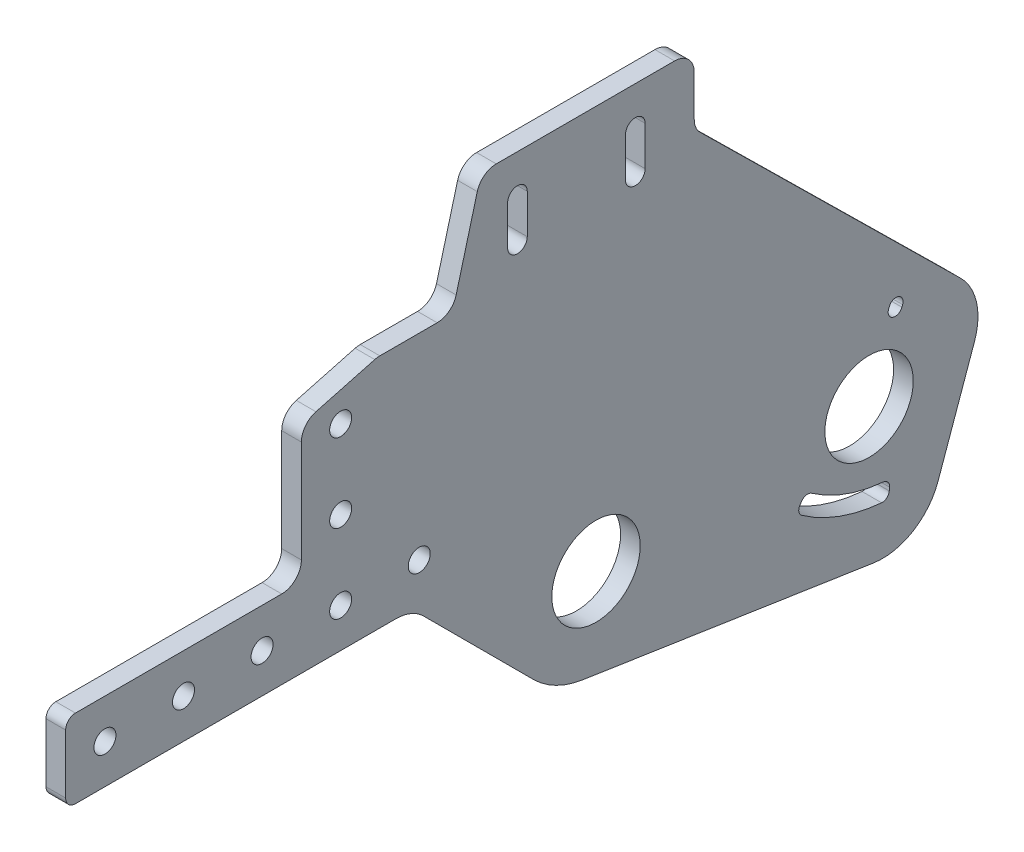
from build123d import *

# Parameters (mm, degrees)
SKETCH2_R           = 14.2875
SKETCH2_R_2         = 3.556
BOSS_EXTRUDE1_DEPTH = 6.35


with BuildPart() as part:
    # Sketch2 → Boss-Extrude1 (new body)
    with BuildSketch(Plane(origin=(0, 0, 0), x_dir=(0, 0, -1), z_dir=(1, 0, 0))):
        with BuildLine():
            Line((-168.275, 19.05), (-64.721664787, 19.05))
            ThreePointArc((-64.721664787, 19.05), (-59.861585196, 18.083270063), (-55.741408666, 15.330256121))
            Line((-55.741408666, 15.330256121), (-20.205576272, -20.205576272))
            ThreePointArc((-20.205576272, -20.205576272), (-12.892391565, -25.501311039), (-4.291950596, -28.250836892))
            Line((-4.291950596, -28.250836892), (89.747072838, -42.537523132))
            ThreePointArc((89.747072838, -42.537523132), (102.395293911, -40.047397767), (110.561944691, -30.073229346))
            Line((110.561944691, -30.073229346), (122.380407257, 3.238704882))
            ThreePointArc((122.380407257, 3.238704882), (122.992543265, 13.876440872), (117.796290753, 23.178865142))
            Line((117.796290753, 23.178865142), (33.643515016, 106.084545773))
            ThreePointArc((33.643515016, 106.084545773), (32.242475794, 108.156147009), (31.75, 110.608066701))
            Line((31.75, 110.608066701), (31.75, 123.825))
            ThreePointArc((31.75, 123.825), (29.890128061, 128.315128061), (25.4, 130.175))
            Line((25.4, 130.175), (-32.251185784, 130.175))
            ThreePointArc((-32.251185784, 130.175), (-36.116820858, 128.862793711), (-38.384814781, 125.468500936))
            Line((-38.384814781, 125.468500936), (-45.22073508, 99.956499064))
            ThreePointArc((-45.22073508, 99.956499064), (-47.488729003, 96.562206289), (-51.354364077, 95.25))
            Line((-51.354364077, 95.25), (-69.879490653, 95.25))
            ThreePointArc((-69.879490653, 95.25), (-70.708331973, 95.19567487), (-71.522991589, 95.033628997))
            Line((-71.522991589, 95.033628997), (-90.543500936, 89.937098878))
            ThreePointArc((-90.543500936, 89.937098878), (-93.937793711, 87.669104955), (-95.25, 83.803469881))
            Line((-95.25, 83.803469881), (-95.25, 50.8))
            ThreePointArc((-95.25, 50.8), (-97.109871939, 46.309871939), (-101.6, 44.45))
            Line((-101.6, 44.45), (-168.275, 44.45))
            ThreePointArc((-168.275, 44.45), (-170.52006403, 43.52006403), (-171.45, 41.275))
            Line((-171.45, 41.275), (-171.45, 22.225))
            ThreePointArc((-171.45, 22.225), (-170.52006403, 19.97993597), (-168.275, 19.05))
        make_face()
        Circle(SKETCH2_R, mode=Mode.SUBTRACT)
        with Locations((-57.15, 31.75)):
            Circle(SKETCH2_R_2, mode=Mode.SUBTRACT)
        with Locations((-82.55, 31.75)):
            Circle(SKETCH2_R_2, mode=Mode.SUBTRACT)
        with Locations((-107.95, 31.75)):
            Circle(SKETCH2_R_2, mode=Mode.SUBTRACT)
        with Locations((-133.35, 31.75)):
            Circle(SKETCH2_R_2, mode=Mode.SUBTRACT)
        with Locations((-158.75, 31.75)):
            Circle(SKETCH2_R_2, mode=Mode.SUBTRACT)
        with Locations((88.260023092, 2.022732411)):
            Circle(SKETCH2_R, mode=Mode.SUBTRACT)
        with Locations((-82.55, 57.15)):
            Circle(SKETCH2_R_2, mode=Mode.SUBTRACT)
        with Locations((-82.55, 82.55)):
            Circle(SKETCH2_R_2, mode=Mode.SUBTRACT)
        with BuildLine():
            Line((94.576884308, 26.061982823), (94.799197401, 26.672783027))
            ThreePointArc((94.799197401, 26.672783027), (97.72919278, 28.03906231), (99.095472064, 25.109066932))
            Line((99.095472064, 25.109066932), (98.87315897, 24.498266728))
            ThreePointArc((98.87315897, 24.498266728), (95.943163592, 23.131987445), (94.576884308, 26.061982823))
        make_face(mode=Mode.SUBTRACT)
        with BuildLine():
            Line((66.519823852, -13.57854466), (65.937070193, -14.410803137))
            ThreePointArc((65.937070193, -14.410803137), (65.558381242, -16.118958605), (66.498456032, -17.594580444))
            ThreePointArc((66.498456032, -17.594580444), (78.790853404, -23.993597488), (92.320584973, -26.993066764))
            ThreePointArc((92.320584973, -26.993066764), (93.989235477, -26.466943281), (94.797124081, -24.915003712))
            Line((94.797124081, -24.915003712), (94.885674315, -23.902869899))
            ThreePointArc((94.885674315, -23.902869899), (94.359550833, -22.234219395), (92.807611263, -21.426330791))
            ThreePointArc((92.807611263, -21.426330791), (80.702061965, -18.742595123), (69.703601159, -13.01715882))
            ThreePointArc((69.703601159, -13.01715882), (67.995445691, -12.63846987), (66.519823852, -13.57854466))
        make_face(mode=Mode.SUBTRACT)
        with BuildLine():
            Line((-22.225, 117.475), (-22.225, 104.775))
            ThreePointArc((-22.225, 104.775), (-25.4, 101.6), (-28.575, 104.775))
            Line((-28.575, 104.775), (-28.575, 117.475))
            ThreePointArc((-28.575, 117.475), (-25.4, 120.65), (-22.225, 117.475))
        make_face(mode=Mode.SUBTRACT)
        with BuildLine():
            Line((15.875, 117.475), (15.875, 104.775))
            ThreePointArc((15.875, 104.775), (12.7, 101.6), (9.525, 104.775))
            Line((9.525, 104.775), (9.525, 117.475))
            ThreePointArc((9.525, 117.475), (12.7, 120.65), (15.875, 117.475))
        make_face(mode=Mode.SUBTRACT)
    extrude(amount=BOSS_EXTRUDE1_DEPTH)


solid = part.part
